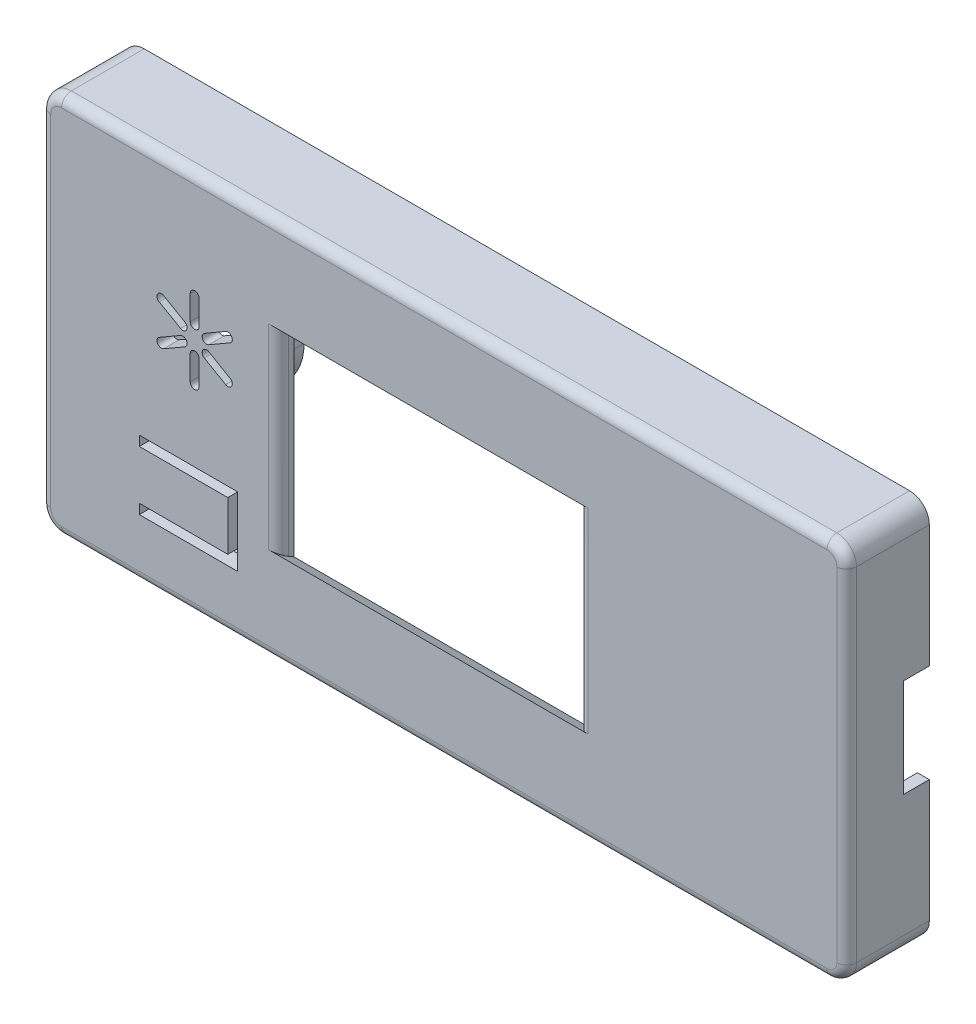
from build123d import *

# Parameters (mm, degrees)
SKIZZE1_W                            = 74
SKIZZE1_H                            = 33
AUFSATZ_LINEAR_AUSTRAGEN5_DEPTH      = 1.5
SCHNITT_LINEAR_AUSTRAGEN1_DEPTH      = 82.038571063
SCHNITT_LINEAR_AUSTRAGEN1_DEPTH_BACK = 82.038571063
SKIZZE1_10_W                         = 29
SKIZZE1_10_H                         = 27.2
SKIZZE1_23_W                         = 78
SKIZZE1_23_H                         = 37
SKIZZE1_23_W_2                       = 74
SKIZZE1_23_H_2                       = 33
AUFSATZ_LINEAR_AUSTRAGEN7_DEPTH      = 6.5
SKIZZE1_24_W                         = 78
SKIZZE1_24_H                         = 37
SKIZZE1_24_W_2                       = 74
SKIZZE1_24_H_2                       = 33
AUFSATZ_LINEAR_AUSTRAGEN8_DEPTH      = 1.5
SKIZZE13_W                           = 23.25
SKIZZE13_H                           = 33
SCHNITT_LINEAR_AUSTRAGEN10_DEPTH     = 0.5
SKIZZE14_W                           = 29
SKIZZE14_H                           = 1.5
SCHNITT_LINEAR_AUSTRAGEN11_DEPTH     = 8
SKIZZE16_W                           = 75.7
SKIZZE16_H                           = 34.7
SCHNITT_LINEAR_AUSTRAGEN12_DEPTH     = 2.5
VERRUNDUNG7_R                        = 2
SKALIEREN1_SCALE                     = 1.05
VERRUNDUNG10_R                       = 1
SKIZZE21_W                           = 30.947992815
SKIZZE21_H                           = 1.575
AUFSATZ_LINEAR_AUSTRAGEN14_DEPTH     = 6
FASE1_SIZE                           = 1
FASE1_SIZE_2                         = 1.732050808
FASE1_OF_SPIEGELN2_SIZE              = 1.732050808
FASE1_OF_SPIEGELN2_SIZE_2            = 1
VERRUNDUNG11_R                       = 1
VERRUNDUNG12_R                       = 2
SCHNITT_LINEAR_AUSTRAGEN13_REACH     = 90.588
SKIZZE23_W                           = 2.625
SKIZZE23_H                           = 10
SCHNITT_LINEAR_AUSTRAGEN14_DEPTH     = 1.575
SKIZZE29_W                           = 9
SKIZZE29_H                           = 5
AUFSATZ_LINEAR_AUSTRAGEN16_DEPTH     = 1
SCHNITT_LINEAR_AUSTRAGEN16_DEPTH     = 1.622146556
AUFSATZ_LINEAR_START                 = -3.652853
AUFSATZ_LINEAR_AUSTRAGEN17_DEPTH     = 3.7


with BuildPart() as part:
    # Skizze1 → Aufsatz-Linear austragen5 (new body)
    with BuildSketch(Plane.XY):
        with Locations((37, 16.5)):
            Rectangle(SKIZZE1_W, SKIZZE1_H)
    extrude(amount=AUFSATZ_LINEAR_AUSTRAGEN5_DEPTH)

    # Skizze1<10> → Schnitt-Linear austragen1 (cut, two sides: drawn at the far end of the back side and taken through both)
    with BuildSketch(Plane.XY.offset(-SCHNITT_LINEAR_AUSTRAGEN1_DEPTH_BACK)):
        with Locations((35.5, 16.5)):
            Rectangle(SKIZZE1_10_W, SKIZZE1_10_H)
    extrude(amount=SCHNITT_LINEAR_AUSTRAGEN1_DEPTH + SCHNITT_LINEAR_AUSTRAGEN1_DEPTH_BACK, mode=Mode.SUBTRACT)



with BuildPart() as body_2:
    # Skizze1<23> → Aufsatz-Linear austragen7 (new body)
    with BuildSketch(Plane.XY):
        with Locations((37, 16.5)):
            Rectangle(SKIZZE1_23_W, SKIZZE1_23_H)
        with Locations((37, 16.5)):
            Rectangle(SKIZZE1_23_W_2, SKIZZE1_23_H_2, mode=Mode.SUBTRACT)
    extrude(amount=-AUFSATZ_LINEAR_AUSTRAGEN7_DEPTH)


with BuildPart() as part_1:
    add(part.part)

    add(body_2.part)  # Aufsatz-Linear austragen8 merges body 2
    # Skizze1<24> → Aufsatz-Linear austragen8 (add)
    with BuildSketch(Plane.XY):
        with Locations((37, 16.5)):
            Rectangle(SKIZZE1_24_W, SKIZZE1_24_H)
        with Locations((37, 16.5)):
            Rectangle(SKIZZE1_24_W_2, SKIZZE1_24_H_2, mode=Mode.SUBTRACT)
    extrude(amount=AUFSATZ_LINEAR_AUSTRAGEN8_DEPTH)

    # Skizze13 → Schnitt-Linear austragen10 (cut)
    with BuildSketch(Plane(origin=(0, 0, 0), x_dir=(-1, 0, 0), z_dir=(0, 0, -1))):
        with Locations((-62.375, 16.5)):
            Rectangle(SKIZZE13_W, SKIZZE13_H)
    extrude(amount=-SCHNITT_LINEAR_AUSTRAGEN10_DEPTH, mode=Mode.SUBTRACT)

    # Skizze14 → Schnitt-Linear austragen11 (cut)
    with BuildSketch(Plane(origin=(0, 0, 0), x_dir=(-1, 0, 0), z_dir=(0, 0, -1))):
        with Locations((-35.5, 30.85)):
            Rectangle(SKIZZE14_W, SKIZZE14_H)
        with Locations((-35.5, 2.15)):
            Rectangle(SKIZZE14_W, SKIZZE14_H)
    extrude(amount=-SCHNITT_LINEAR_AUSTRAGEN11_DEPTH, mode=Mode.SUBTRACT)

    # Skizze16 → Schnitt-Linear austragen12 (cut)
    with BuildSketch(Plane(origin=(0, 0, -6.5), x_dir=(-1, 0, 0), z_dir=(0, 0, -1))):
        with Locations((-37, 16.5)):
            Rectangle(SKIZZE16_W, SKIZZE16_H)
    extrude(amount=-SCHNITT_LINEAR_AUSTRAGEN12_DEPTH, mode=Mode.SUBTRACT)

    # Verrundung7
    verrundung7_edges = [part_1.edges().sort_by_distance(p)[0] for p in [
        (-2, 35, -2.5),
        (-2, -2, -2.5),
    ]]
    fillet(verrundung7_edges, radius=VERRUNDUNG7_R)


with BuildPart() as part_2:
    # Skalieren1: scaled about (35.565157989, 16.5, -0.942931129)
    add(part_1.part.scale(SKALIEREN1_SCALE).moved(Location((-1.778257899, -0.825, 0.047146556))))

    # Verrundung10
    verrundung10_edges = [part_2.edges().sort_by_distance(p)[0] for p in [
        (-3.878257899, 16.5, 1.622146556),
        (38.121742101, 35.925, 1.622146556),
        (38.121742101, -2.925, 1.622146556),
        (-3.26318214, -2.30992424, 1.622146556),
        (-3.26318214, 35.30992424, 1.622146556),
        (78.021742101, 16.5, 1.622146556),
    ]]
    fillet(verrundung10_edges, radius=VERRUNDUNG10_R)

    # Skizze21 → Aufsatz-Linear austragen14 (add)
    with BuildSketch(Plane.XZ.offset(-32.355)):
        with Locations((35.745738508, 0.834646556)):
            Rectangle(SKIZZE21_W, SKIZZE21_H)
    aufsatz_linear_austragen14 = extrude(amount=AUFSATZ_LINEAR_AUSTRAGEN14_DEPTH)

    # Fase1
    # the kernel refuses this chamfer: 1.732050808, 1 mm, written as the material it takes off along each edge
    with BuildSketch(Plane(origin=(50.721742101, 26.355, 0.047146556), x_dir=(0, 0.998322743753016, -0.05789386241606277), z_dir=(-1, 0, 0))) as fase1_piece_1:
        Polygon((FASE1_SIZE * 0.998322743754, -FASE1_SIZE * 0.0578938624023), (-FASE1_SIZE_2 * 0.0578938624017, -FASE1_SIZE_2 * 0.998322743505), (0, 0), align=None)
    extrude(amount=30.45, mode=Mode.SUBTRACT)

    # Spiegeln2: Aufsatz-Linear austragen14 across plane
    add(aufsatz_linear_austragen14.mirror(Plane.ZX.offset(16.5)))

    # Fase1 of Spiegeln2
    # the kernel refuses this chamfer: 1.732050808, 1 mm, written as the material it takes off along each edge
    with BuildSketch(Plane(origin=(50.721742101, 6.645, 0.047146556), x_dir=(0, 0.019326765612583986, 0.9998132206222101), z_dir=(-1, 0, 0))) as fase1_of_spiegeln2_piece_1:
        Polygon((FASE1_OF_SPIEGELN2_SIZE * 0.999813220373, -FASE1_OF_SPIEGELN2_SIZE * 0.0193267656078), (-FASE1_OF_SPIEGELN2_SIZE_2 * 0.0193267656264, -FASE1_OF_SPIEGELN2_SIZE_2 * 0.999813220622), (0, 0), align=None)
    extrude(amount=30.45, mode=Mode.SUBTRACT)

    # Verrundung11
    verrundung11_edges = [part_2.edges().sort_by_distance(p)[0] for p in [
        (50.721742101, 16.5, 1.622146556),
        (20.271742101, 16.5, 1.622146556),
    ]]
    fillet(verrundung11_edges, radius=VERRUNDUNG11_R)

    # Verrundung12
    # the kernel refuses this fillet: 2 mm, written as the material it takes off along each edge
    with BuildSketch(Plane(origin=(76.021742101, -0.925, 1.622146556), x_dir=(0, -1, 0), z_dir=(-1, 0, 0))) as verrundung12_piece_1:
        with BuildLine():
            CenterArc((1, -1), 1, 0, 90)
            Line((2, -1), (2, 0))
            Line((2, 0), (1, 0))
        make_face()
    revolve(axis=Axis((76.021742101, -0.925, 1.622146556), (0, 0, 1)), revolution_arc=90, mode=Mode.SUBTRACT)
    with BuildSketch(Plane(origin=(76.021742101, 33.925, 1.622146556), x_dir=(1, 0, 0), z_dir=(0, -1, 0))) as verrundung12_piece_2:
        with BuildLine():
            CenterArc((1, -1), 1, 0, 90)
            Line((2, -1), (2, 0))
            Line((2, 0), (1, 0))
        make_face()
    revolve(axis=Axis((76.021742101, 33.925, 1.622146556), (0, 0, 1)), revolution_arc=90, mode=Mode.SUBTRACT)
    with BuildSketch(Plane(origin=(78.021742101, -2.925, 1.622146556), x_dir=(0, 1, 0), z_dir=(0, 0, -1))) as verrundung12_piece_3:
        with BuildLine():
            CenterArc((VERRUNDUNG12_R, -VERRUNDUNG12_R), VERRUNDUNG12_R, 90, 90)
            Line((0, -VERRUNDUNG12_R), (0, 0))
            Line((0, 0), (VERRUNDUNG12_R, 0))
        make_face()
    extrude(amount=13.4, mode=Mode.SUBTRACT)
    with BuildSketch(Plane(origin=(78.021742101, 35.925, 1.622146556), x_dir=(0, -1, 0), z_dir=(0, 0, -1))) as verrundung12_piece_4:
        with BuildLine():
            CenterArc((VERRUNDUNG12_R, VERRUNDUNG12_R), VERRUNDUNG12_R, 180, 90)
            Line((0, VERRUNDUNG12_R), (0, 0))
            Line((0, 0), (VERRUNDUNG12_R, 0))
        make_face()
    extrude(amount=13.4, mode=Mode.SUBTRACT)

    # Skizze23 → Schnitt-Linear austragen13 (cut, up to next)
    with BuildSketch(Plane.ZY.offset(-76.814242101), mode=Mode.PRIVATE) as schnitt_linear_austragen13_sk1:
        with Locations((-5.465353444, 16.5)):
            Rectangle(SKIZZE23_W, SKIZZE23_H)
    schnitt_linear_austragen13_tool1 = extrude(schnitt_linear_austragen13_sk1.sketch, amount=-SCHNITT_LINEAR_AUSTRAGEN13_REACH, mode=Mode.PRIVATE) & part_2.part
    add(schnitt_linear_austragen13_tool1.solids().sort_by_distance((76.814242, 16.5, -5.465353))[0], mode=Mode.SUBTRACT)

    # Skizze26 → Schnitt-Rotation1 (revolve, cut)
    with BuildSketch(Plane.XZ.offset(-34.7175)):
        with BuildLine():
            Line((16, -5.377853444), (37, -5.377853444))
            Line((37, -5.377853444), (37, -4.777853444))
            Line((37, -4.777853444), (16.6, -4.777853444))
            ThreePointArc((16.6, -4.777853444), (16.175735931, -4.953589375), (16, -5.377853444))
        make_face()
    schnitt_rotation1 = revolve(axis=Axis((16, 34.7175, -5.377853444), (1, 0, 0)), mode=Mode.SUBTRACT)

    # Spiegeln3: Schnitt-Rotation1 across plane
    add(schnitt_rotation1.mirror(Plane.ZY.offset(-37)), mode=Mode.SUBTRACT)

    # Spiegeln4: Schnitt-Rotation1 across plane
    add(schnitt_rotation1.mirror(Plane.ZX.offset(16.5)), mode=Mode.SUBTRACT)

    # Spiegeln4 copy 1 sketch → Spiegeln4 copy 1 (revolve, cut)
    with BuildSketch(Plane(origin=(74, -1.7175, 0), x_dir=(-1, 0, 0), z_dir=(0, 1, 0))):
        with BuildLine():
            Line((16, -5.377853444), (37, -5.377853444))
            Line((37, -5.377853444), (37, -4.777853444))
            Line((37, -4.777853444), (16.6, -4.777853444))
            ThreePointArc((16.6, -4.777853444), (16.175735931, -4.953589375), (16, -5.377853444))
        make_face()
    revolve(axis=Axis((58, -1.7175, -5.377853444), (-1, 0, 0)), mode=Mode.SUBTRACT)

    # Skizze27 → Schnitt-Linear austragen14 (cut)
    with BuildSketch(Plane.XY.offset(1.622146556)):
        Polygon((6.121742101, 10.075), (16.121742101, 10.075), (16.121742101, 3.075), (6.121742101, 3.075), (6.121742101, 4.075), (15.121742101, 4.075), (15.121742101, 9.075), (6.121742101, 9.075), align=None)
    extrude(amount=-SCHNITT_LINEAR_AUSTRAGEN14_DEPTH, mode=Mode.SUBTRACT)

    # Skizze1<36> → Schnitt-Linear austragen16 (cut)
    with BuildSketch(Plane.XY):
        with BuildLine():
            Line((8.597750966, 23.590144421), (10.762814476, 22.340144421))
            ThreePointArc((10.762814476, 22.340144421), (10.927525907, 21.725432989), (10.312814476, 21.560721557))
            Line((10.312814476, 21.560721557), (8.147750966, 22.810721557))
            ThreePointArc((8.147750966, 22.810721557), (7.983039534, 23.425432989), (8.597750966, 23.590144421))
        make_face()
        with BuildLine():
            Line((11.300946332, 25.149105086), (11.300946332, 22.649105086))
            ThreePointArc((11.300946332, 22.649105086), (11.750946332, 22.199105086), (12.200946332, 22.649105086))
            Line((12.200946332, 22.649105086), (12.200946332, 25.149105086))
            ThreePointArc((12.200946332, 25.149105086), (11.750946332, 25.599105086), (11.300946332, 25.149105086))
        make_face()
        with BuildLine():
            Line((14.902643555, 23.587549559), (12.737580045, 22.337549559))
            ThreePointArc((12.737580045, 22.337549559), (12.572868614, 21.722838128), (13.187580045, 21.558126696))
            Line((13.187580045, 21.558126696), (15.352643555, 22.808126696))
            ThreePointArc((15.352643555, 22.808126696), (15.517354987, 23.422838128), (14.902643555, 23.587549559))
        make_face()
        with BuildLine():
            Line((15.351145411, 19.687610505), (13.186081901, 20.937610505))
            ThreePointArc((13.186081901, 20.937610505), (12.57137047, 20.772899073), (12.736081901, 20.158187641))
            Line((12.736081901, 20.158187641), (14.901145411, 18.908187641))
            ThreePointArc((14.901145411, 18.908187641), (15.515856843, 19.072899073), (15.351145411, 19.687610505))
        make_face()
        with BuildLine():
            Line((12.197950045, 17.349226977), (12.197950045, 19.849226977))
            ThreePointArc((12.197950045, 19.849226977), (11.747950045, 20.299226977), (11.297950045, 19.849226977))
            Line((11.297950045, 19.849226977), (11.297950045, 17.349226977))
            ThreePointArc((11.297950045, 17.349226977), (11.747950045, 16.899226977), (12.197950045, 17.349226977))
        make_face()
        with BuildLine():
            Line((8.596252822, 18.910782503), (10.761316332, 20.160782503))
            ThreePointArc((10.761316332, 20.160782503), (10.926027763, 20.775493935), (10.311316332, 20.940205366))
            Line((10.311316332, 20.940205366), (8.146252822, 19.690205366))
            ThreePointArc((8.146252822, 19.690205366), (7.98154139, 19.075493935), (8.596252822, 18.910782503))
        make_face()
    extrude(amount=SCHNITT_LINEAR_AUSTRAGEN16_DEPTH, mode=Mode.SUBTRACT)

    # Skizze1<38> → Aufsatz-Linear austragen17 (add)
    with BuildSketch(Plane.XY.offset(AUFSATZ_LINEAR_START)):
        with BuildLine():
            ThreePointArc((17.6, 21.251), (11.75, 27.100000085), (5.9, 21.251))
            ThreePointArc((5.9, 21.251), (11.75, 15.401999915), (17.6, 21.251))
        make_face()
        with BuildLine():
            ThreePointArc((16.099999885, 21.251), (15.954866713, 20.137730767), (15.529646414, 19.09868326))
            ThreePointArc((15.529646414, 19.09868326), (15.515612726, 19.07247678), (15.499879375, 19.047254058))
            ThreePointArc((15.499879375, 19.047254058), (13.931904838, 17.48878445), (11.800380036, 16.902291751))
            ThreePointArc((11.800380036, 16.902291751), (11.747713679, 16.899227039), (11.695050571, 16.902347076))
            ThreePointArc((11.695050571, 16.902347076), (9.57009197, 17.487627412), (8.004784464, 19.039340833))
            ThreePointArc((8.004784464, 19.039340833), (7.981580622, 19.075425996), (7.961918578, 19.113556841))
            ThreePointArc((7.961918578, 19.113556841), (7.542951432, 20.145997131), (7.400000115, 21.251))
            ThreePointArc((7.400000115, 21.251), (11.75, 25.6), (16.099999885, 21.251))
        make_face(mode=Mode.SUBTRACT)
    extrude(amount=AUFSATZ_LINEAR_AUSTRAGEN17_DEPTH)


with BuildPart() as body_2_2:
    # Skizze29 → Aufsatz-Linear austragen16 (new body)
    with BuildSketch(Plane(origin=(0, 0, 0.047146556), x_dir=(-1, 0, 0), z_dir=(0, 0, -1))):
        with Locations((-10.621742101, 6.575)):
            Rectangle(SKIZZE29_W, SKIZZE29_H)
    extrude(amount=AUFSATZ_LINEAR_AUSTRAGEN16_DEPTH)


solid = Compound([part_2.part, body_2_2.part])
